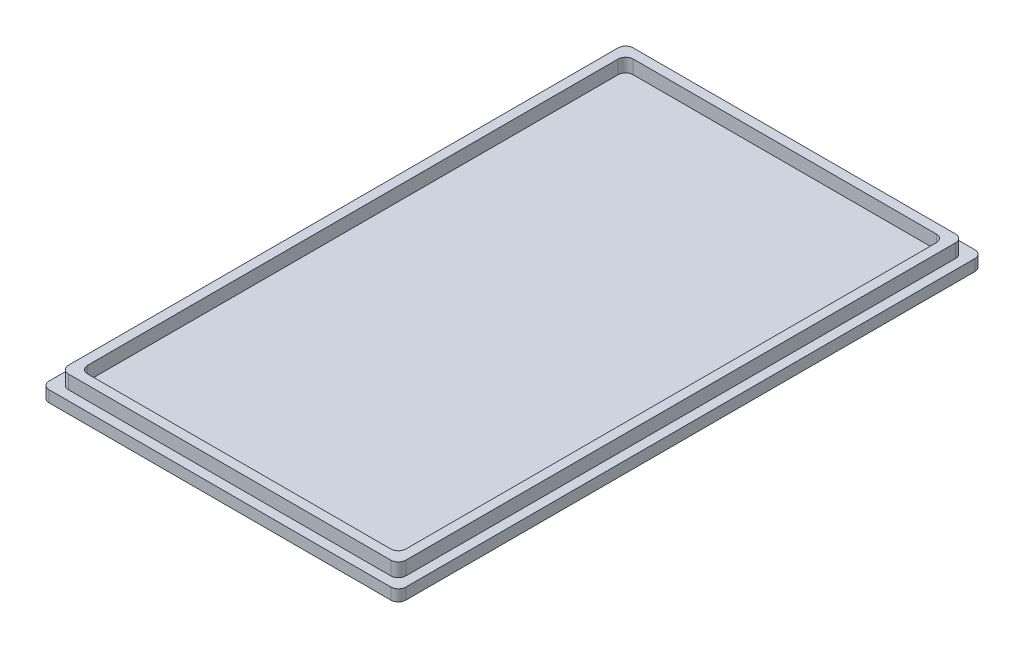
from build123d import *

# Parameters (mm, degrees)
SKETCH1_W           = 47.09116882
SKETCH1_H           = 77.09116882
BOSS_EXTRUDE1_DEPTH = 1.5
SKETCH2_W           = 44.545584412
SKETCH2_H           = 74.545584412
SKETCH2_W_2         = 42
SKETCH2_H_2         = 72
BOSS_EXTRUDE2_DEPTH = 1.8
FILLET1_R           = 1
SKETCH3_W           = 24
SKETCH3_H           = 64
BOSS_EXTRUDE3_DEPTH = 10
SKETCH4_W           = 48
SKETCH4_H           = 6
CUT_EXTRUDE1_DEPTH  = 24
FILLET2_R           = 6
FILLET3_R           = 1


with BuildPart() as part:
    # Sketch1 → Boss-Extrude1 (new body)
    with BuildSketch(Plane(origin=(0, 0, 0), x_dir=(1, 0, 0), z_dir=(0, 1, 0))):
        with Locations((23.54558441, -38.54558441)):
            Rectangle(SKETCH1_W, SKETCH1_H)
    extrude(amount=BOSS_EXTRUDE1_DEPTH)

    # Sketch2 → Boss-Extrude2 (add)
    with BuildSketch(Plane(origin=(0, 1.5, 0), x_dir=(1, 0, 0), z_dir=(0, 1, 0))):
        with Locations((23.545584412, -38.545584412)):
            Rectangle(SKETCH2_W, SKETCH2_H)
        with Locations((23.545584412, -38.545584412)):
            Rectangle(SKETCH2_W_2, SKETCH2_H_2, mode=Mode.SUBTRACT)
    extrude(amount=BOSS_EXTRUDE2_DEPTH)

    # Fillet1
    fillet1_edges = [part.edges().sort_by_distance(p)[0] for p in [
        (2.545584412, 2.4, 2.545584412),
        (1.272792206, 2.4, 1.272792206),
        (0, 0.75, 0),
        (2.545584412, 2.4, 74.545584412),
        (1.272792206, 2.4, 75.818376618),
        (0, 0.75, 77.09116882),
        (44.545584412, 2.4, 74.545584412),
        (47.09116882, 0.75, 77.09116882),
        (45.818376618, 2.4, 75.818376618),
        (44.545584412, 2.4, 2.545584412),
        (47.09116882, 0.75, 0),
        (45.818376618, 2.4, 1.272792206),
    ]]
    fillet(fillet1_edges, radius=FILLET1_R)

    # Sketch3 → Boss-Extrude3 (add)
    with BuildSketch(Plane.XZ):
        with Locations((23.54558441, 38.542813716)):
            Rectangle(SKETCH3_W, SKETCH3_H)
    extrude(amount=BOSS_EXTRUDE3_DEPTH)

    # Sketch4 → Cut-Extrude1 (cut)
    with BuildSketch(Plane.ZY.offset(-11.54558441)):
        with Locations((38.542813716, -3)):
            Rectangle(SKETCH4_W, SKETCH4_H)
    extrude(amount=-CUT_EXTRUDE1_DEPTH, mode=Mode.SUBTRACT)

    # Fillet2
    fillet2_edges = [part.edges().sort_by_distance(p)[0] for p in [
        (23.54558441, -10, 70.542813716),
        (23.54558441, -10, 6.542813716),
    ]]
    fillet(fillet2_edges, radius=FILLET2_R)

    # Fillet3
    fillet3_edges = [part.edges().sort_by_distance(p)[0] for p in [
        (23.54558441, -6, 62.542813716),
        (23.54558441, -6, 14.542813716),
    ]]
    fillet(fillet3_edges, radius=FILLET3_R)


solid = part.part
